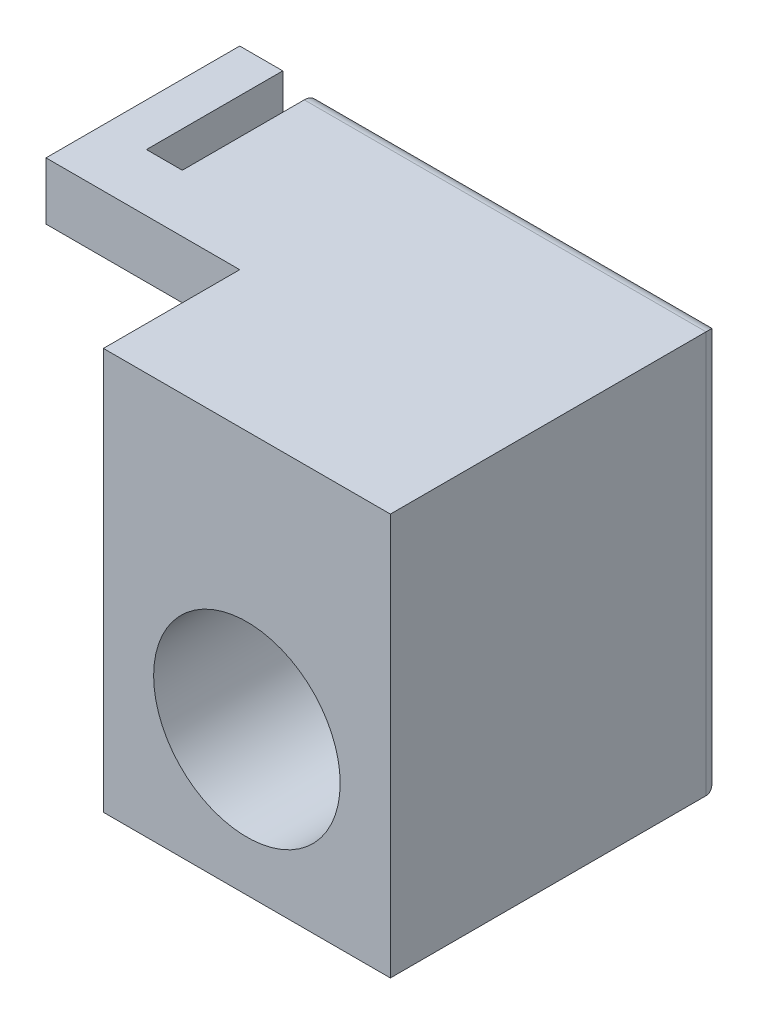
from build123d import *
from build123d.topology import SkipClean

# Parameters (mm, degrees)
SKETCH1_W           = 20
SKETCH1_H           = 28
BOSS_EXTRUDE1_DEPTH = 23
SKETCH2_R           = 6.5
CUT_EXTRUDE1_DEPTH  = 40
SKETCH3_R           = 2.75
CUT_EXTRUDE2_DEPTH  = 10
THREAD1_PITCH       = 2.116666667
SKETCH6_R           = 3.75
CUT_EXTRUDE3_DEPTH  = 1
SKETCH7_W           = 13.5
SKETCH7_H           = 4
BOSS_EXTRUDE2_DEPTH = 13.5
SKETCH8_W           = 2.5
SKETCH8_H           = 9.5
CUT_EXTRUDE4_DEPTH  = 10
FILLET1_R           = 1


with BuildPart() as part:
    # Sketch1 → Boss-Extrude1 (new body)
    with BuildSketch(Plane.XY):
        with Locations((-10, -14)):
            Rectangle(SKETCH1_W, SKETCH1_H)
    extrude(amount=BOSS_EXTRUDE1_DEPTH)

    # Sketch2 → Cut-Extrude1 (cut)
    with BuildSketch(Plane.XY.offset(23)):
        with Locations((-10, -18)):
            Circle(SKETCH2_R)
    extrude(amount=-CUT_EXTRUDE1_DEPTH, mode=Mode.SUBTRACT)

    # Sketch3 → Cut-Extrude2 (cut)
    with BuildSketch(Plane.ZY.offset(20)):
        with Locations((8, -18)):
            Circle(SKETCH3_R)
    extrude(amount=-CUT_EXTRUDE2_DEPTH, mode=Mode.SUBTRACT)

    # Thread1: the profile of Thread Profile1 profile screwed along a right-hand helix of 4.724409 turns, 10 arcs to a turn; built about Z, then put on its axis
    with SkipClean():  # the faces are left unmerged after this step: merging them gives an invalid solid
        thread1_z = Axis((0, 0, 0), (0, 0, 1))
        thread1_corners = [(2.7497, 0, -0.000173205), (3.895679435, 0, 0.66145833), (3.895679435, 0, 0.926041664), (2.7497, 0, 1.587673199)]
        with BuildLine(mode=Mode.PRIVATE) as thread1_profile:
            Line(thread1_corners[0], thread1_corners[1])
            Line(thread1_corners[1], thread1_corners[2])
            Line(thread1_corners[2], thread1_corners[3])
            Line(thread1_corners[3], thread1_corners[0])
        thread1_cap = Face(thread1_profile.wire())
        thread1_turn_angles = [0, 18, 36, 54, 72, 90, 108, 126, 144, 162, 180, 198, 216, 234, 252, 270, 288, 306, 324, 342, 360]
        thread1_turn_weights = [1, 0.9510565162951535, 1, 0.9510565162951535, 1, 0.9510565162951535, 1, 0.9510565162951535, 1, 0.9510565162951535, 1, 0.9510565162951535, 1, 0.9510565162951535, 1, 0.9510565162951535, 1, 0.9510565162951535, 1, 0.9510565162951535, 1]
        thread1_turn_rails = [Edge.make_bspline([Vector(p[0], p[1], 0).rotate(thread1_z, thread1_turn_angles[k]) / thread1_turn_weights[k] + Vector(0, 0, p[2] + THREAD1_PITCH * thread1_turn_angles[k] / 360) for k in range(21)], [0, 0, 0, 1, 1, 2, 2, 3, 3, 4, 4, 5, 5, 6, 6, 7, 7, 8, 8, 9, 9, 10, 10, 10], 2, thread1_turn_weights) for p in thread1_corners]
        thread1_turn_sides = [Face.make_surface_from_curves(thread1_turn_rails[p[0]], thread1_turn_rails[p[1]]) for p in [(0, 1), (1, 2), (2, 3), (3, 0)]]
        thread1_last_angles = [1440, 1458, 1476, 1494, 1512, 1530, 1548, 1566, 1584, 1602, 1620, 1638, 1656, 1674, 1692, 1696.393700787, 1700.787401575]
        thread1_last_weights = [1, 0.9510565162951535, 1, 0.9510565162951535, 1, 0.9510565162951535, 1, 0.9510565162951535, 1, 0.9510565162951535, 1, 0.9510565162951535, 1, 0.9510565162951535, 1, 0.9970611808444934, 1]
        thread1_last_rails = [Edge.make_bspline([Vector(p[0], p[1], 0).rotate(thread1_z, thread1_last_angles[k]) / thread1_last_weights[k] + Vector(0, 0, p[2] + THREAD1_PITCH * thread1_last_angles[k] / 360) for k in range(17)], [0, 0, 0, 1, 1, 2, 2, 3, 3, 4, 4, 5, 5, 6, 6, 7, 7, 8, 8, 8], 2, thread1_last_weights) for p in thread1_corners]
        thread1_last_sides = [Face.make_surface_from_curves(thread1_last_rails[p[0]], thread1_last_rails[p[1]]) for p in [(0, 1), (1, 2), (2, 3), (3, 0)]]
        thread1 = Plane(origin=(-20, -18, 8), x_dir=(0, 0, -1), z_dir=(1, 0, 0)) * Solid(Shell([*[p.moved(Location((0, 0, THREAD1_PITCH * i))) for i in range(4) for p in thread1_turn_sides], *thread1_last_sides, thread1_cap, thread1_cap.rotate(thread1_z, 1700.787401575).moved(Location((0, 0, THREAD1_PITCH * 1700.787401575 / 360)))]))
        add(thread1, mode=Mode.SUBTRACT)

    # Sketch6 → Cut-Extrude3 (cut)
    with BuildSketch(Plane.ZY.offset(20)):
        with Locations((8, -18)):
            Circle(SKETCH6_R)
    extrude(amount=-CUT_EXTRUDE3_DEPTH, mode=Mode.SUBTRACT)

    # Sketch7 → Boss-Extrude2 (add)
    with BuildSketch(Plane.ZY.offset(20)):
        with Locations((6.75, -2)):
            Rectangle(SKETCH7_W, SKETCH7_H)
    extrude(amount=BOSS_EXTRUDE2_DEPTH)

    # Sketch8 → Cut-Extrude4 (cut)
    with BuildSketch(Plane(origin=(0, -4, 0), x_dir=(-1, 0, 0), z_dir=(0, -1, 0))):
        with Locations((29.25, -4.75)):
            Rectangle(SKETCH8_W, SKETCH8_H)
    extrude(amount=-CUT_EXTRUDE4_DEPTH, mode=Mode.SUBTRACT)

    # Fillet1
    fillet1_edges = [part.edges().sort_by_distance(p)[0] for p in [
        (-10, -28, 0),
        (-14, 0, 0),
        (0, -14, 0),
        (-20, -16, 0),
        (-24, -4, 0),
    ]]
    fillet(fillet1_edges, radius=FILLET1_R)


solid = part.part
